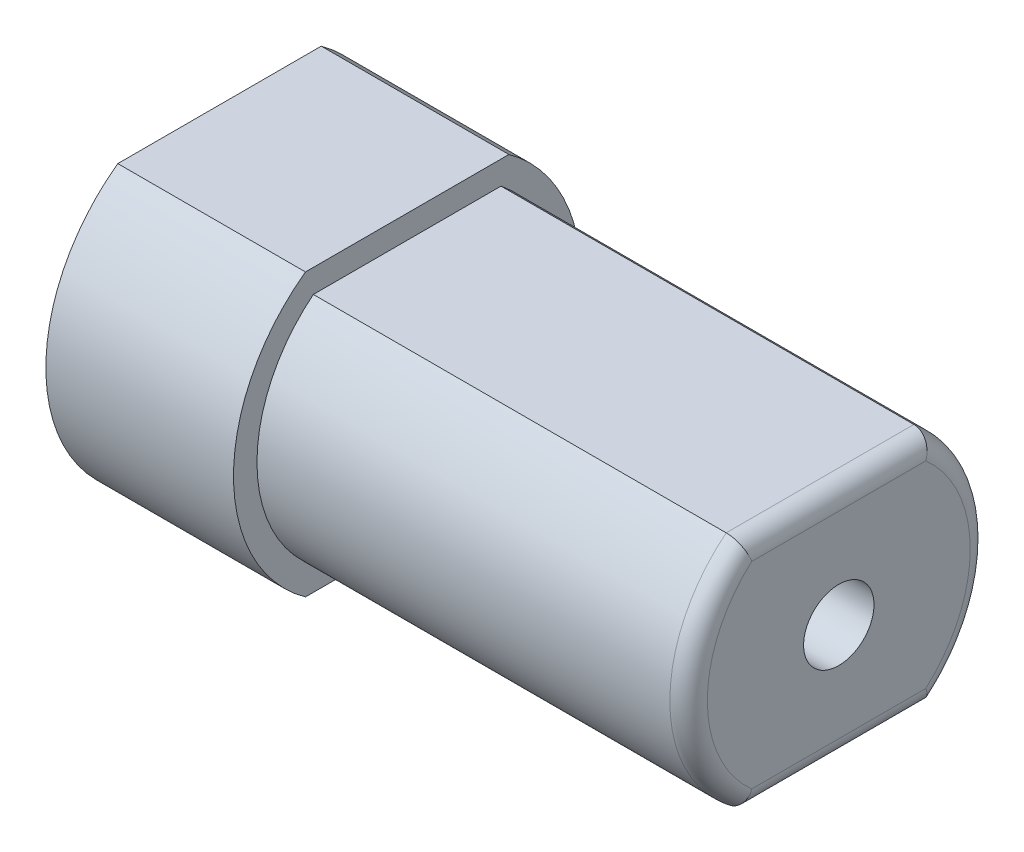
from build123d import *

# Parameters (mm, degrees)
BOSS_EXTRUDE1_DEPTH = 58.42
SKETCH2_R           = 4.7625
CUT_EXTRUDE1_DEPTH  = 25.4
BOSS_EXTRUDE2_DEPTH = 25.4
FILLET1_R           = 2.54


with BuildPart() as part:
    # Sketch1 → Boss-Extrude1 (new body)
    with BuildSketch(Plane(origin=(0, 0, 0), x_dir=(0, 0, -1), z_dir=(1, 0, 0))):
        with BuildLine():
            Line((-12.7, -15.875), (12.7, -15.875))
            ThreePointArc((12.7, -15.875), (20.329919454, 0), (12.7, 15.875))
            Line((12.7, 15.875), (-12.7, 15.875))
            ThreePointArc((-12.7, 15.875), (-20.329919454, 0), (-12.7, -15.875))
        make_face()
    extrude(amount=BOSS_EXTRUDE1_DEPTH)

    # Sketch2 → Cut-Extrude1 (cut)
    with BuildSketch(Plane(origin=(58.42, 0, 0), x_dir=(0, 0, -1), z_dir=(1, 0, 0))):
        Circle(SKETCH2_R)
    extrude(amount=-CUT_EXTRUDE1_DEPTH, mode=Mode.SUBTRACT)

    # Sketch4 → Boss-Extrude2 (add)
    with BuildSketch(Plane.ZY):
        with BuildLine():
            Line((-13.768759513, -19.05), (13.768759513, -19.05))
            ThreePointArc((13.768759513, -19.05), (23.504919454, 0), (13.768759513, 19.05))
            Line((13.768759513, 19.05), (-13.768759513, 19.05))
            ThreePointArc((-13.768759513, 19.05), (-23.504919454, 0), (-13.768759513, -19.05))
        make_face()
    extrude(amount=BOSS_EXTRUDE2_DEPTH)

    # Fillet1
    fillet1_edges = [part.edges().sort_by_distance(p)[0] for p in [
        (58.42, 0, -20.329919454),
        (58.42, 15.875, 0),
        (58.42, 0, 20.329919454),
        (58.42, -15.875, 0),
    ]]
    fillet(fillet1_edges, radius=FILLET1_R)


solid = part.part
